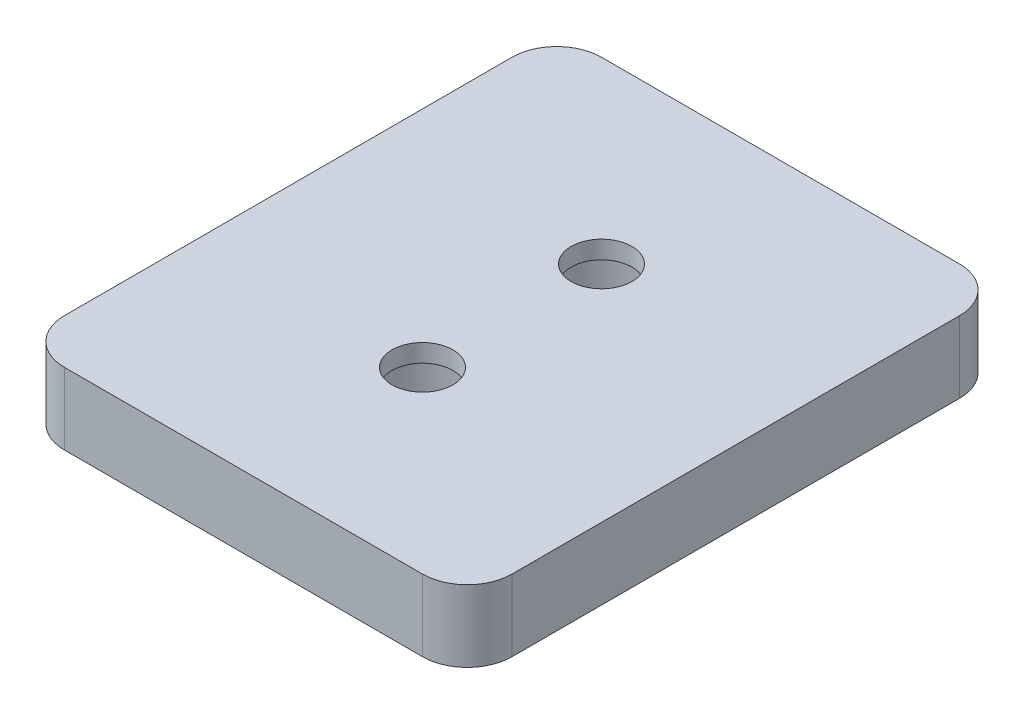
from build123d import *

# Parameters (mm, degrees)
SKETCH1_W                      = 25
SKETCH1_H                      = 30
BOSS_EXTRUDE1_DEPTH            = 4
CBORE_FOR_M3_SHCS2_D           = 3.4
CBORE_FOR_M3_SHCS2_CBORE_D     = 6.5
CBORE_FOR_M3_SHCS2_CBORE_DEPTH = 3
FILLET1_R                      = 2.5


with BuildPart() as part:
    # Sketch1 → Boss-Extrude1 (new body)
    with BuildSketch(Plane(origin=(0, 0, 0), x_dir=(1, 0, 0), z_dir=(0, 1, 0))):
        with Locations((12.5, 15)):
            Rectangle(SKETCH1_W, SKETCH1_H)
    extrude(amount=BOSS_EXTRUDE1_DEPTH)

    # CBORE for M3 SHCS2 (through all)
    with Locations(Plane(origin=(0, 0, 0), x_dir=(-1, 0, 0), z_dir=(0, -1, 0))):
        with Locations((-12.5, 20), (-12.5, 10)):
            CounterBoreHole(CBORE_FOR_M3_SHCS2_D / 2, CBORE_FOR_M3_SHCS2_CBORE_D / 2, CBORE_FOR_M3_SHCS2_CBORE_DEPTH)

    # Fillet1
    fillet1_edges = [part.edges().sort_by_distance(p)[0] for p in [
        (0, 2, -30),
        (0, 2, 0),
        (25, 2, 0),
        (25, 2, -30),
    ]]
    fillet(fillet1_edges, radius=FILLET1_R)


solid = part.part
